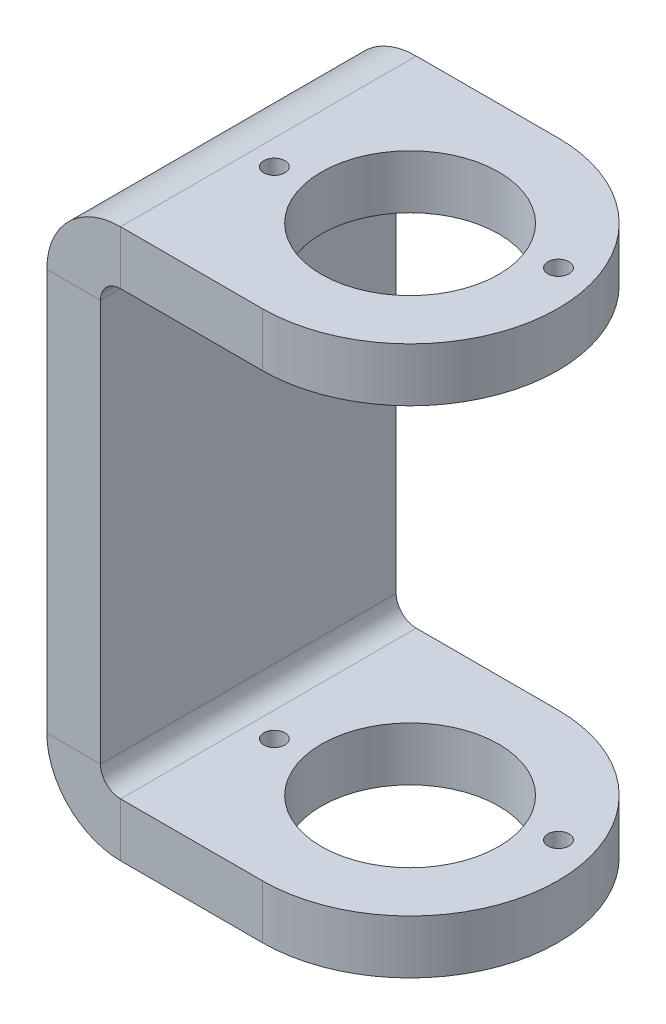
from build123d import *

# Parameters (mm, degrees)
BASE_FLANGE1_DEPTH        = 17.5
FILLET3_RADIUS            = 17.5
FILLET3_LENGTH            = 6.35
FILLET4_RADIUS            = 17.5
FILLET4_LENGTH            = 6.35
CUT_EXTRUDE6_DEPTH        = 57.670097935
CUT_EXTRUDE6_DEPTH_BACK   = 57.670097935
SKETCH23_R                = 10.5
M3X0_5_TAPPED_HOLE1_D     = 2.5
M3X0_5_TAPPED_HOLE1_DEPTH = 6.35
M3X0_5_TAPPED_HOLE2_D     = 2.5


# Sheet-metal steps are written as plain solids
with BuildPart() as part:
    # Sketch20 → Base-Flange1 (new, symmetric)
    with BuildSketch(Plane.XY):
        with BuildLine():
            Line((43, -32.5), (8.730000066, -32.5))
            ThreePointArc((8.730000066, -32.5), (2.55695782, -29.94304218), (0, -23.769999934))
            Line((0, -23.769999934), (0, 23.769999934))
            ThreePointArc((0, 23.769999934), (2.55695782, 29.94304218), (8.730000066, 32.5))
            Line((8.730000066, 32.5), (43, 32.5))
            Line((43, 32.5), (43, 26.15))
            Line((43, 26.15), (8.730000066, 26.15))
            ThreePointArc((8.730000066, 26.15), (7.04708588, 25.45291412), (6.35, 23.769999934))
            Line((6.35, 23.769999934), (6.35, -23.769999934))
            ThreePointArc((6.35, -23.769999934), (7.04708588, -25.45291412), (8.730000066, -26.15))
            Line((8.730000066, -26.15), (43, -26.15))
            Line((43, -26.15), (43, -32.5))
        make_face()
    extrude(amount=BASE_FLANGE1_DEPTH, both=True)

    # Fillet3: full round fillet: the end face becomes a half cylinder, R = half its width
    fillet3_face = Plane((43, 29.325, 0), x_dir=(0, 1, 0), z_dir=(1, 0, 0))  # on the end face: x along it, z out of the body
    fillet3_slab = fillet3_face.offset(-FILLET3_RADIUS / 2) * Box(FILLET3_LENGTH, 2 * FILLET3_RADIUS, FILLET3_RADIUS, mode=Mode.PRIVATE)  # the body's end, R deep
    fillet3_round = Plane((25.5, 29.325, 0), x_dir=(1, 0, 0), z_dir=(0, 1, 0)) * Cylinder(FILLET3_RADIUS, FILLET3_LENGTH, mode=Mode.PRIVATE)  # its axis R under the face
    add(fillet3_slab - fillet3_round, mode=Mode.SUBTRACT)

    # Fillet4: full round fillet: the end face becomes a half cylinder, R = half its width
    fillet4_face = Plane((43, -29.325, 0), x_dir=(0, 1, 0), z_dir=(1, 0, 0))  # on the end face: x along it, z out of the body
    fillet4_slab = fillet4_face.offset(-FILLET4_RADIUS / 2) * Box(FILLET4_LENGTH, 2 * FILLET4_RADIUS, FILLET4_RADIUS, mode=Mode.PRIVATE)  # the body's end, R deep
    fillet4_round = Plane((25.5, -29.325, 0), x_dir=(1, 0, 0), z_dir=(0, 1, 0)) * Cylinder(FILLET4_RADIUS, FILLET4_LENGTH, mode=Mode.PRIVATE)  # its axis R under the face
    add(fillet4_slab - fillet4_round, mode=Mode.SUBTRACT)

    # Sketch23 → Cut-Extrude6 (cut, two sides: drawn at the far end of the back side and taken through both)
    with BuildSketch(Plane(origin=(0, 0, 0), x_dir=(1, 0, 0), z_dir=(0, 1, 0)).offset(-CUT_EXTRUDE6_DEPTH_BACK)):
        with Locations(Location((25.5, 0, 0), (0, 0, 270))):
            Circle(SKETCH23_R)
    extrude(amount=CUT_EXTRUDE6_DEPTH + CUT_EXTRUDE6_DEPTH_BACK, mode=Mode.SUBTRACT)

    # M3x0.5 Tapped Hole1
    with Locations(Plane(origin=(0, 32.5, 0), x_dir=(1, 0, 0), z_dir=(0, 1, 0))):
        with Locations((38.85199985, 4.21), (11.681986395, -2.25)):
            Hole(M3X0_5_TAPPED_HOLE1_D / 2, depth=M3X0_5_TAPPED_HOLE1_DEPTH)

    # M3x0.5 Tapped Hole2 (through all)
    with Locations(Plane(origin=(0, -32.5, 0), x_dir=(-1, 0, 0), z_dir=(0, -1, 0))):
        with Locations((-11.681986395, -2.25), (-38.85199985, 4.21)):
            Hole(M3X0_5_TAPPED_HOLE2_D / 2)


solid = part.part
